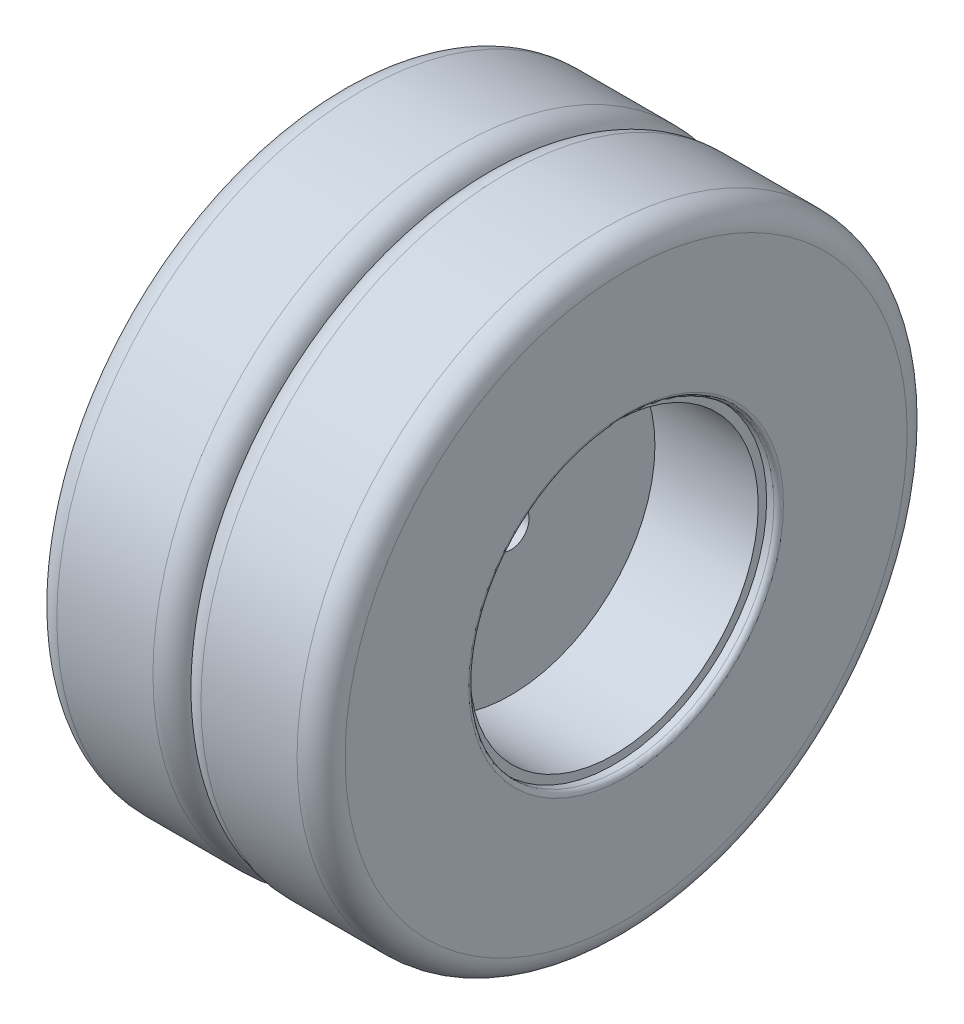
from build123d import *

# Parameters (mm, degrees)
HUB_START      = 5
SKETCH1_R      = 63.5
SKETCH1_R_2    = 7.625
HUB_FACE_DEPTH = 7
SKETCH2_R      = 63.5
SKETCH2_R_2    = 60
HUB_DEPTH      = 50
SKETCH3_R      = 127
SKETCH3_R_2    = 63.5
RUBBER_DEPTH   = 60
FILLET1_R      = 10
FILLET2_R      = 2


with BuildPart() as part:
    # Sketch1 → Hub Face (new body)
    with BuildSketch(Plane(origin=(0, 0, 0), x_dir=(0, 0, -1), z_dir=(1, 0, 0)).offset(HUB_START)):
        Circle(SKETCH1_R)
        Circle(SKETCH1_R_2, mode=Mode.SUBTRACT)
    extrude(amount=HUB_FACE_DEPTH)

    # Sketch2 → Hub (add)
    with BuildSketch(Plane(origin=(0, 0, 0), x_dir=(0, 0, -1), z_dir=(1, 0, 0)).offset(HUB_START)):
        Circle(SKETCH2_R)
        Circle(SKETCH2_R_2, mode=Mode.SUBTRACT)
    extrude(amount=HUB_DEPTH)

    # Sketch3 → Rubber (add)
    with BuildSketch(Plane(origin=(0, 0, 0), x_dir=(0, 0, -1), z_dir=(1, 0, 0))):
        Circle(SKETCH3_R)
        Circle(SKETCH3_R_2, mode=Mode.SUBTRACT)
    extrude(amount=RUBBER_DEPTH)

    # Fillet1
    fillet1_edges = [part.edges().sort_by_distance(p)[0] for p in [
        (0, 0, 127),
        (60, 0, 127),
    ]]
    fillet(fillet1_edges, radius=FILLET1_R)

    # Fillet2
    fillet2_edges = [part.edges().sort_by_distance(p)[0] for p in [
        (60, 0, 63.5),
        (0, 0, 63.5),
    ]]
    fillet(fillet2_edges, radius=FILLET2_R)


with BuildPart() as body_2:
    # Mirror1: mirrored copy
    add(part.part.mirror(Plane(origin=(0, 0, 0), x_dir=(0, 0, 1), z_dir=(1, 0, 0))))


solid = Compound([part.part, body_2.part])
